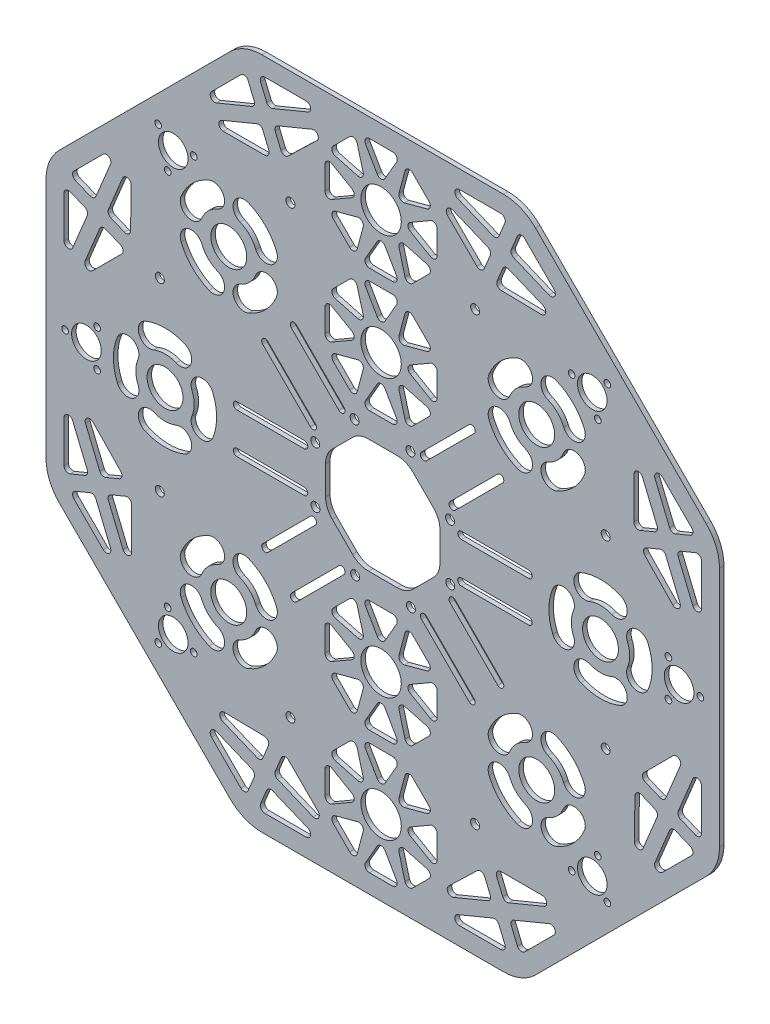
from build123d import *

# Parameters (mm, degrees)
EXTRUDE_1_DEPTH       = 2
SKETCH_2_R            = 6.6
SKETCH_2_R_2          = 1.5
CUT_EXTRUDE_1_DEPTH   = 10
CUT_EXTRUDE_2_DEPTH   = 10
MIRROR_4_COPY_1_DEPTH = 10
MIRROR_4_COPY_2_DEPTH = 10
FILLET_1_R            = 20
SKETCH_4_R            = 2
CUT_EXTRUDE_3_DEPTH   = 10
CUT_EXTRUDE_4_DEPTH   = 35
FILLET_2_R            = 10
SKETCH_6_R            = 2
CUT_EXTRUDE_5_DEPTH   = 35
SKETCH_9_R            = 8
CUT_EXTRUDE_8_DEPTH   = 10
SKETCH_10_R           = 9
CUT_EXTRUDE_9_DEPTH   = 10
FILLET_3_R            = 2


with BuildPart() as part:
    # 草图1 → 凸台-拉伸1 (new body)
    with BuildSketch(Plane.XY):
        Polygon((150, 62.132034356), (62.132034356, 150), (-62.132034356, 150), (-150, 62.132034356), (-150, -62.132034356), (-62.132034356, -150), (62.132034356, -150), (150, -62.132034356), align=None)
    extrude(amount=EXTRUDE_1_DEPTH)

    # 草图2 → 切除-拉伸1 (cut)
    with BuildSketch(Plane(origin=(0, 0, 0), x_dir=(-1, 0, 0), z_dir=(0, 0, -1))):
        with Locations((-132, 0)):
            Circle(SKETCH_2_R)
        with Locations((-141.5, 0)):
            Circle(SKETCH_2_R_2)
        with Locations((-127.25, 8.227241336)):
            Circle(SKETCH_2_R_2)
        with Locations((-127.25, -8.227241336)):
            Circle(SKETCH_2_R_2)
        with Locations((-93.338095117, 93.338095117)):
            Circle(SKETCH_2_R)
        with Locations((-100.055609538, 100.055609538)):
            Circle(SKETCH_2_R_2)
        with Locations((-84.161799767, 95.796876045)):
            Circle(SKETCH_2_R_2)
        with Locations((-95.796876045, 84.161799767)):
            Circle(SKETCH_2_R_2)
        with Locations((93.338095117, 93.338095117)):
            Circle(SKETCH_2_R)
        with Locations((100.055609538, 100.055609538)):
            Circle(SKETCH_2_R_2)
        with Locations((95.796876045, 84.161799767)):
            Circle(SKETCH_2_R_2)
        with Locations((84.161799767, 95.796876045)):
            Circle(SKETCH_2_R_2)
        with Locations((132, 0)):
            Circle(SKETCH_2_R)
        with Locations((141.5, 0)):
            Circle(SKETCH_2_R_2)
        with Locations((127.25, -8.227241336)):
            Circle(SKETCH_2_R_2)
        with Locations((127.25, 8.227241336)):
            Circle(SKETCH_2_R_2)
        with Locations((93.338095117, -93.338095117)):
            Circle(SKETCH_2_R)
        with Locations((100.055609538, -100.055609538)):
            Circle(SKETCH_2_R_2)
        with Locations((84.161799767, -95.796876045)):
            Circle(SKETCH_2_R_2)
        with Locations((95.796876045, -84.161799767)):
            Circle(SKETCH_2_R_2)
        with Locations((-93.338095117, -93.338095117)):
            Circle(SKETCH_2_R)
        with Locations((-100.055609538, -100.055609538)):
            Circle(SKETCH_2_R_2)
        with Locations((-95.796876045, -84.161799767)):
            Circle(SKETCH_2_R_2)
        with Locations((-84.161799767, -95.796876045)):
            Circle(SKETCH_2_R_2)
    extrude(amount=-CUT_EXTRUDE_1_DEPTH, mode=Mode.SUBTRACT)

    # 草图3 → 切除-拉伸2 (cut)
    with BuildSketch(Plane(origin=(0, 0, 0), x_dir=(-1, 0, 0), z_dir=(0, 0, -1))):
        with BuildLine():
            Line((-65, -7.4), (-35, -7.4))
            ThreePointArc((-35, -7.4), (-33.4, -9), (-35, -10.6))
            Line((-35, -10.6), (-65, -10.6))
            ThreePointArc((-65, -10.6), (-66.6, -9), (-65, -7.4))
        make_face()
        with BuildLine():
            Line((-65, 10.6), (-35, 10.6))
            ThreePointArc((-35, 10.6), (-33.4, 9), (-35, 7.4))
            Line((-35, 7.4), (-65, 7.4))
            ThreePointArc((-65, 7.4), (-66.6, 9), (-65, 10.6))
        make_face()
    cut_extrude_2 = extrude(amount=-CUT_EXTRUDE_2_DEPTH, mode=Mode.SUBTRACT)

    # 镜向2: 切除-拉伸2 across plane
    add(cut_extrude_2.mirror(Plane(origin=(0, 0, 0), x_dir=(0, 0, 1), z_dir=(-0.38268343236509006, 0.9238795325112866, 0))), mode=Mode.SUBTRACT)

    # 镜向3: 切除-拉伸2 across plane
    add(cut_extrude_2.mirror(Plane(origin=(0, 0, 0), x_dir=(0, 0, 1), z_dir=(0.38268343236508967, 0.9238795325112868, 0))), mode=Mode.SUBTRACT)

    # 镜向4: 切除-拉伸2 across plane
    add(cut_extrude_2.mirror(Plane(origin=(0, 0, 0), x_dir=(0, 0, 1), z_dir=(1, 0, 0))), mode=Mode.SUBTRACT)

    # 镜向4 copy 1 sketch → 镜向4 copy 1 (cut)
    with BuildSketch(Plane(origin=(0, 0, 0), x_dir=(0.707106781186547, -0.7071067811865479, 0), z_dir=(0, 0, -1))):
        with BuildLine():
            Line((-65, -7.4), (-35, -7.4))
            ThreePointArc((-35, -7.4), (-33.4, -9), (-35, -10.6))
            Line((-35, -10.6), (-65, -10.6))
            ThreePointArc((-65, -10.6), (-66.6, -9), (-65, -7.4))
        make_face()
        with BuildLine():
            Line((-65, 10.6), (-35, 10.6))
            ThreePointArc((-35, 10.6), (-33.4, 9), (-35, 7.4))
            Line((-35, 7.4), (-65, 7.4))
            ThreePointArc((-65, 7.4), (-66.6, 9), (-65, 10.6))
        make_face()
    extrude(amount=-MIRROR_4_COPY_1_DEPTH, mode=Mode.SUBTRACT)

    # 镜向4 copy 2 sketch → 镜向4 copy 2 (cut)
    with BuildSketch(Plane(origin=(0, 0, 0), x_dir=(0.7071067811865477, 0.7071067811865475, 0), z_dir=(0, 0, -1))):
        with BuildLine():
            Line((-65, -7.4), (-35, -7.4))
            ThreePointArc((-35, -7.4), (-33.4, -9), (-35, -10.6))
            Line((-35, -10.6), (-65, -10.6))
            ThreePointArc((-65, -10.6), (-66.6, -9), (-65, -7.4))
        make_face()
        with BuildLine():
            Line((-65, 10.6), (-35, 10.6))
            ThreePointArc((-35, 10.6), (-33.4, 9), (-35, 7.4))
            Line((-35, 7.4), (-65, 7.4))
            ThreePointArc((-65, 7.4), (-66.6, 9), (-65, 10.6))
        make_face()
    extrude(amount=-MIRROR_4_COPY_2_DEPTH, mode=Mode.SUBTRACT)

    # 圆角1
    fillet_1_edges = [part.edges().sort_by_distance(p)[0] for p in [
        (150, -62.132034356, 1),
        (62.132034356, -150, 1),
        (-62.132034356, -150, 1),
        (-150, -62.132034356, 1),
        (-150, 62.132034356, 1),
        (-62.132034356, 150, 1),
        (62.132034356, 150, 1),
        (150, 62.132034356, 1),
    ]]
    fillet(fillet_1_edges, radius=FILLET_1_R)

    # 草图4 → 切除-拉伸3 (cut)
    with BuildSketch(Plane(origin=(0, 0, 0), x_dir=(-1, 0, 0), z_dir=(0, 0, -1))):
        with Locations((-99.317049745, -41.138468979)):
            Circle(SKETCH_4_R)
        with Locations((-99.317049745, 41.138468979)):
            Circle(SKETCH_4_R)
        with Locations((-41.138468979, 99.317049745)):
            Circle(SKETCH_4_R)
        with Locations((41.138468979, 99.317049745)):
            Circle(SKETCH_4_R)
        with Locations((99.317049745, 41.138468979)):
            Circle(SKETCH_4_R)
        with Locations((99.317049745, -41.138468979)):
            Circle(SKETCH_4_R)
        with Locations((41.138468979, -99.317049745)):
            Circle(SKETCH_4_R)
        with Locations((-41.138468979, -99.317049745)):
            Circle(SKETCH_4_R)
    extrude(amount=-CUT_EXTRUDE_3_DEPTH, mode=Mode.SUBTRACT)

    # 草图5 → 切除-拉伸4 (cut)
    with BuildSketch(Plane.XY.offset(2)):
        Polygon((25.47687194, 10.552865884), (10.552865884, 25.47687194), (-10.552865884, 25.47687194), (-25.47687194, 10.552865884), (-25.47687194, -10.552865884), (-10.552865884, -25.47687194), (10.552865884, -25.47687194), (25.47687194, -10.552865884), align=None)
    extrude(amount=-CUT_EXTRUDE_4_DEPTH, mode=Mode.SUBTRACT)

    # 圆角2
    fillet_2_edges = [part.edges().sort_by_distance(p)[0] for p in [
        (25.47687194, 10.552865884, 1),
        (25.47687194, -10.552865884, 1),
        (10.552865884, -25.47687194, 1),
        (-10.552865884, -25.47687194, 1),
        (-25.47687194, -10.552865884, 1),
        (-25.47687194, 10.552865884, 1),
        (-10.552865884, 25.47687194, 1),
        (10.552865884, 25.47687194, 1),
    ]]
    fillet(fillet_2_edges, radius=FILLET_2_R)

    # 草图6 → 切除-拉伸5 (cut)
    with BuildSketch(Plane.XY.offset(2)):
        with Locations((-30.071355541, 12.327350727)):
            Circle(SKETCH_6_R)
        with Locations((-12.546906129, 29.980412716)):
            Circle(SKETCH_6_R)
        with Locations((12.327350727, 30.071355541)):
            Circle(SKETCH_6_R)
        with Locations((29.980412716, 12.546906129)):
            Circle(SKETCH_6_R)
        with Locations((30.071355541, -12.327350727)):
            Circle(SKETCH_6_R)
        with Locations((12.546906129, -29.980412716)):
            Circle(SKETCH_6_R)
        with Locations((-12.327350727, -30.071355541)):
            Circle(SKETCH_6_R)
        with Locations((-29.980412716, -12.546906129)):
            Circle(SKETCH_6_R)
    extrude(amount=-CUT_EXTRUDE_5_DEPTH, mode=Mode.SUBTRACT)

    # 草图9 → 切除-拉伸8 (cut)
    with BuildSketch(Plane.XY.offset(2)):
        with Locations((97, 0)):
            Circle(SKETCH_9_R)
        with Locations((68.589357775, -68.589357775)):
            Circle(SKETCH_9_R)
        with Locations((-68.589357775, -68.589357775)):
            Circle(SKETCH_9_R)
        with Locations((-97, 0)):
            Circle(SKETCH_9_R)
        with Locations((-68.589357775, 68.589357775)):
            Circle(SKETCH_9_R)
        with Locations((68.589357775, 68.589357775)):
            Circle(SKETCH_9_R)
        with BuildLine():
            ThreePointArc((88.198281056, -21.249229248), (97, -23), (105.801718944, -21.249229248))
            ThreePointArc((105.801718944, -21.249229248), (108.507699445, -14.716414423), (101.974884621, -12.010433923))
            ThreePointArc((101.974884621, -12.010433923), (97, -13), (92.025115379, -12.010433923))
            ThreePointArc((92.025115379, -12.010433923), (85.492300555, -14.716414423), (88.198281056, -21.249229248))
        make_face()
        with BuildLine():
            ThreePointArc((75.750770752, 8.801718944), (74, 0), (75.750770752, -8.801718944))
            ThreePointArc((75.750770752, -8.801718944), (82.283585577, -11.507699445), (84.989566077, -4.974884621))
            ThreePointArc((84.989566077, -4.974884621), (84, 0), (84.989566077, 4.974884621))
            ThreePointArc((84.989566077, 4.974884621), (82.283585577, 11.507699445), (75.750770752, 8.801718944))
        make_face()
        with BuildLine():
            ThreePointArc((105.801718944, 21.249229248), (97, 23), (88.198281056, 21.249229248))
            ThreePointArc((88.198281056, 21.249229248), (85.492300555, 14.716414423), (92.025115379, 12.010433923))
            ThreePointArc((92.025115379, 12.010433923), (97, 13), (101.974884621, 12.010433923))
            ThreePointArc((101.974884621, 12.010433923), (108.507699445, 14.716414423), (105.801718944, 21.249229248))
        make_face()
        with BuildLine():
            ThreePointArc((118.249229248, -8.801718944), (120, 0), (118.249229248, 8.801718944))
            ThreePointArc((118.249229248, 8.801718944), (111.716414423, 11.507699445), (109.010433923, 4.974884621))
            ThreePointArc((109.010433923, 4.974884621), (110, 0), (109.010433923, -4.974884621))
            ThreePointArc((109.010433923, -4.974884621), (111.716414423, -11.507699445), (118.249229248, -8.801718944))
        make_face()
        with BuildLine():
            ThreePointArc((47.340128527, -77.391076719), (52.325901808, -84.852813742), (59.787638831, -89.838587023))
            ThreePointArc((59.787638831, -89.838587023), (66.320453655, -87.132606522), (63.614473154, -80.599791698))
            ThreePointArc((63.614473154, -80.599791698), (59.39696962, -77.781745931), (56.578923852, -73.564242396))
            ThreePointArc((56.578923852, -73.564242396), (50.046109028, -70.858261895), (47.340128527, -77.391076719))
        make_face()
        with BuildLine():
            ThreePointArc((59.787638831, -47.340128527), (52.325901808, -52.325901808), (47.340128527, -59.787638831))
            ThreePointArc((47.340128527, -59.787638831), (50.046109028, -66.320453655), (56.578923852, -63.614473154))
            ThreePointArc((56.578923852, -63.614473154), (59.39696962, -59.39696962), (63.614473154, -56.578923852))
            ThreePointArc((63.614473154, -56.578923852), (66.320453655, -50.046109028), (59.787638831, -47.340128527))
        make_face()
        with BuildLine():
            ThreePointArc((89.838587023, -59.787638831), (84.852813742, -52.325901808), (77.391076719, -47.340128527))
            ThreePointArc((77.391076719, -47.340128527), (70.858261895, -50.046109028), (73.564242396, -56.578923852))
            ThreePointArc((73.564242396, -56.578923852), (77.781745931, -59.39696962), (80.599791698, -63.614473154))
            ThreePointArc((80.599791698, -63.614473154), (87.132606522, -66.320453655), (89.838587023, -59.787638831))
        make_face()
        with BuildLine():
            ThreePointArc((77.391076719, -89.838587023), (84.852813742, -84.852813742), (89.838587023, -77.391076719))
            ThreePointArc((89.838587023, -77.391076719), (87.132606522, -70.858261895), (80.599791698, -73.564242396))
            ThreePointArc((80.599791698, -73.564242396), (77.781745931, -77.781745931), (73.564242396, -80.599791698))
            ThreePointArc((73.564242396, -80.599791698), (70.858261895, -87.132606522), (77.391076719, -89.838587023))
        make_face()
        with BuildLine():
            ThreePointArc((-77.391076719, -47.340128527), (-84.852813742, -52.325901808), (-89.838587023, -59.787638831))
            ThreePointArc((-89.838587023, -59.787638831), (-87.132606522, -66.320453655), (-80.599791698, -63.614473154))
            ThreePointArc((-80.599791698, -63.614473154), (-77.781745931, -59.39696962), (-73.564242396, -56.578923852))
            ThreePointArc((-73.564242396, -56.578923852), (-70.858261895, -50.046109028), (-77.391076719, -47.340128527))
        make_face()
        with BuildLine():
            ThreePointArc((-47.340128527, -59.787638831), (-52.325901808, -52.325901808), (-59.787638831, -47.340128527))
            ThreePointArc((-59.787638831, -47.340128527), (-66.320453655, -50.046109028), (-63.614473154, -56.578923852))
            ThreePointArc((-63.614473154, -56.578923852), (-59.39696962, -59.39696962), (-56.578923852, -63.614473154))
            ThreePointArc((-56.578923852, -63.614473154), (-50.046109028, -66.320453655), (-47.340128527, -59.787638831))
        make_face()
        with BuildLine():
            ThreePointArc((-59.787638831, -89.838587023), (-52.325901808, -84.852813742), (-47.340128527, -77.391076719))
            ThreePointArc((-47.340128527, -77.391076719), (-50.046109028, -70.858261895), (-56.578923852, -73.564242396))
            ThreePointArc((-56.578923852, -73.564242396), (-59.39696962, -77.781745931), (-63.614473154, -80.599791698))
            ThreePointArc((-63.614473154, -80.599791698), (-66.320453655, -87.132606522), (-59.787638831, -89.838587023))
        make_face()
        with BuildLine():
            ThreePointArc((-89.838587023, -77.391076719), (-84.852813742, -84.852813742), (-77.391076719, -89.838587023))
            ThreePointArc((-77.391076719, -89.838587023), (-70.858261895, -87.132606522), (-73.564242396, -80.599791698))
            ThreePointArc((-73.564242396, -80.599791698), (-77.781745931, -77.781745931), (-80.599791698, -73.564242396))
            ThreePointArc((-80.599791698, -73.564242396), (-87.132606522, -70.858261895), (-89.838587023, -77.391076719))
        make_face()
        with BuildLine():
            ThreePointArc((-88.198281056, 21.249229248), (-97, 23), (-105.801718944, 21.249229248))
            ThreePointArc((-105.801718944, 21.249229248), (-108.507699445, 14.716414423), (-101.974884621, 12.010433923))
            ThreePointArc((-101.974884621, 12.010433923), (-97, 13), (-92.025115379, 12.010433923))
            ThreePointArc((-92.025115379, 12.010433923), (-85.492300555, 14.716414423), (-88.198281056, 21.249229248))
        make_face()
        with BuildLine():
            ThreePointArc((-75.750770752, -8.801718944), (-74, 0), (-75.750770752, 8.801718944))
            ThreePointArc((-75.750770752, 8.801718944), (-82.283585577, 11.507699445), (-84.989566077, 4.974884621))
            ThreePointArc((-84.989566077, 4.974884621), (-84, 0), (-84.989566077, -4.974884621))
            ThreePointArc((-84.989566077, -4.974884621), (-82.283585577, -11.507699445), (-75.750770752, -8.801718944))
        make_face()
        with BuildLine():
            ThreePointArc((-105.801718944, -21.249229248), (-97, -23), (-88.198281056, -21.249229248))
            ThreePointArc((-88.198281056, -21.249229248), (-85.492300555, -14.716414423), (-92.025115379, -12.010433923))
            ThreePointArc((-92.025115379, -12.010433923), (-97, -13), (-101.974884621, -12.010433923))
            ThreePointArc((-101.974884621, -12.010433923), (-108.507699445, -14.716414423), (-105.801718944, -21.249229248))
        make_face()
        with BuildLine():
            ThreePointArc((-118.249229248, 8.801718944), (-120, 0), (-118.249229248, -8.801718944))
            ThreePointArc((-118.249229248, -8.801718944), (-111.716414423, -11.507699445), (-109.010433923, -4.974884621))
            ThreePointArc((-109.010433923, -4.974884621), (-110, 0), (-109.010433923, 4.974884621))
            ThreePointArc((-109.010433923, 4.974884621), (-111.716414423, 11.507699445), (-118.249229248, 8.801718944))
        make_face()
        with BuildLine():
            ThreePointArc((-47.340128527, 77.391076719), (-52.325901808, 84.852813742), (-59.787638831, 89.838587023))
            ThreePointArc((-59.787638831, 89.838587023), (-66.320453655, 87.132606522), (-63.614473154, 80.599791698))
            ThreePointArc((-63.614473154, 80.599791698), (-59.39696962, 77.781745931), (-56.578923852, 73.564242396))
            ThreePointArc((-56.578923852, 73.564242396), (-50.046109028, 70.858261895), (-47.340128527, 77.391076719))
        make_face()
        with BuildLine():
            ThreePointArc((-59.787638831, 47.340128527), (-52.325901808, 52.325901808), (-47.340128527, 59.787638831))
            ThreePointArc((-47.340128527, 59.787638831), (-50.046109028, 66.320453655), (-56.578923852, 63.614473154))
            ThreePointArc((-56.578923852, 63.614473154), (-59.39696962, 59.39696962), (-63.614473154, 56.578923852))
            ThreePointArc((-63.614473154, 56.578923852), (-66.320453655, 50.046109028), (-59.787638831, 47.340128527))
        make_face()
        with BuildLine():
            ThreePointArc((-89.838587023, 59.787638831), (-84.852813742, 52.325901808), (-77.391076719, 47.340128527))
            ThreePointArc((-77.391076719, 47.340128527), (-70.858261895, 50.046109028), (-73.564242396, 56.578923852))
            ThreePointArc((-73.564242396, 56.578923852), (-77.781745931, 59.39696962), (-80.599791698, 63.614473154))
            ThreePointArc((-80.599791698, 63.614473154), (-87.132606522, 66.320453655), (-89.838587023, 59.787638831))
        make_face()
        with BuildLine():
            ThreePointArc((-77.391076719, 89.838587023), (-84.852813742, 84.852813742), (-89.838587023, 77.391076719))
            ThreePointArc((-89.838587023, 77.391076719), (-87.132606522, 70.858261895), (-80.599791698, 73.564242396))
            ThreePointArc((-80.599791698, 73.564242396), (-77.781745931, 77.781745931), (-73.564242396, 80.599791698))
            ThreePointArc((-73.564242396, 80.599791698), (-70.858261895, 87.132606522), (-77.391076719, 89.838587023))
        make_face()
        with BuildLine():
            ThreePointArc((77.391076719, 47.340128527), (84.852813742, 52.325901808), (89.838587023, 59.787638831))
            ThreePointArc((89.838587023, 59.787638831), (87.132606522, 66.320453655), (80.599791698, 63.614473154))
            ThreePointArc((80.599791698, 63.614473154), (77.781745931, 59.39696962), (73.564242396, 56.578923852))
            ThreePointArc((73.564242396, 56.578923852), (70.858261895, 50.046109028), (77.391076719, 47.340128527))
        make_face()
        with BuildLine():
            ThreePointArc((47.340128527, 59.787638831), (52.325901808, 52.325901808), (59.787638831, 47.340128527))
            ThreePointArc((59.787638831, 47.340128527), (66.320453655, 50.046109028), (63.614473154, 56.578923852))
            ThreePointArc((63.614473154, 56.578923852), (59.39696962, 59.39696962), (56.578923852, 63.614473154))
            ThreePointArc((56.578923852, 63.614473154), (50.046109028, 66.320453655), (47.340128527, 59.787638831))
        make_face()
        with BuildLine():
            ThreePointArc((59.787638831, 89.838587023), (52.325901808, 84.852813742), (47.340128527, 77.391076719))
            ThreePointArc((47.340128527, 77.391076719), (50.046109028, 70.858261895), (56.578923852, 73.564242396))
            ThreePointArc((56.578923852, 73.564242396), (59.39696962, 77.781745931), (63.614473154, 80.599791698))
            ThreePointArc((63.614473154, 80.599791698), (66.320453655, 87.132606522), (59.787638831, 89.838587023))
        make_face()
        with BuildLine():
            ThreePointArc((89.838587023, 77.391076719), (84.852813742, 84.852813742), (77.391076719, 89.838587023))
            ThreePointArc((77.391076719, 89.838587023), (70.858261895, 87.132606522), (73.564242396, 80.599791698))
            ThreePointArc((73.564242396, 80.599791698), (77.781745931, 77.781745931), (80.599791698, 73.564242396))
            ThreePointArc((80.599791698, 73.564242396), (87.132606522, 70.858261895), (89.838587023, 77.391076719))
        make_face()
    extrude(amount=-CUT_EXTRUDE_8_DEPTH, mode=Mode.SUBTRACT)

    # 草图10 → 切除-拉伸9 (cut)
    with BuildSketch(Plane.XY.offset(2)):
        with Locations((-0.743983155, -61.624947898)):
            Circle(SKETCH_10_R)
        with Locations((-0.743983155, -116.624947898)):
            Circle(SKETCH_10_R)
        with Locations((-0.743983155, 61.624947898)):
            Circle(SKETCH_10_R)
        with Locations((-0.743983155, 116.624947898)):
            Circle(SKETCH_10_R)
        Polygon((6.327084657, -54.553880086), (23.057410732, -50.071002725), (10.809962018, -37.823554011), align=None)
        Polygon((-0.743983155, -51.624947898), (7.916270883, -36.624947898), (-9.404237193, -36.624947898), align=None)
        Polygon((9.256016845, -61.624947898), (24.256016845, -70.285201936), (24.256016845, -52.96469386), align=None)
        Polygon((6.327084657, -68.69601571), (10.809962018, -85.426341784), (23.057410732, -73.17889307), align=None)
        Polygon((-0.743983155, -71.624947898), (-9.404237193, -86.624947898), (7.916270883, -86.624947898), align=None)
        Polygon((-7.815050967, -68.69601571), (-24.545377041, -73.17889307), (-12.297928327, -85.426341784), align=None)
        Polygon((-10.743983155, -61.624947898), (-25.743983155, -52.96469386), (-25.743983155, -70.285201936), align=None)
        Polygon((-7.815050967, -54.553880086), (-12.297928327, -37.823554011), (-24.545377041, -50.071002725), align=None)
        Polygon((6.327084657, -109.553880086), (23.057410732, -105.071002725), (10.809962018, -92.823554011), align=None)
        Polygon((-0.743983155, -106.624947898), (7.916270883, -91.624947898), (-9.404237193, -91.624947898), align=None)
        Polygon((9.256016845, -116.624947898), (24.256016845, -125.285201936), (24.256016845, -107.96469386), align=None)
        Polygon((6.327084657, -123.69601571), (10.809962018, -140.426341784), (23.057410732, -128.17889307), align=None)
        Polygon((-0.743983155, -126.624947898), (-9.404237193, -141.624947898), (7.916270883, -141.624947898), align=None)
        Polygon((-7.815050967, -123.69601571), (-24.545377041, -128.17889307), (-12.297928327, -140.426341784), align=None)
        Polygon((-10.743983155, -116.624947898), (-25.743983155, -107.96469386), (-25.743983155, -125.285201936), align=None)
        Polygon((-7.815050967, -109.553880086), (-12.297928327, -92.823554011), (-24.545377041, -105.071002725), align=None)
        Polygon((83.407078974, -117.411246883), (61.114426451, -139.703899406), (56.497466943, -128.557573144), align=None)
        Polygon((55.571149256, -142), (24.044577716, -142), (50.954189748, -130.853673738), align=None)
        Polygon((21.748477122, -136.456722805), (44.26530041, -114.705266382), (48.658089154, -125.310396543), align=None)
        Polygon((49.584406841, -111.867969688), (81.11097838, -111.867969688), (54.201366349, -123.014295949), align=None)
        Polygon((-24.044577716, -142), (-55.571149256, -142), (-50.954189748, -130.853673738), align=None)
        Polygon((-61.114426451, -139.703899406), (-83.407078974, -117.411246883), (-56.497466943, -128.557573144), align=None)
        Polygon((-81.11097838, -111.867969688), (-49.808577605, -112.409165788), (-54.201366349, -123.014295949), align=None)
        Polygon((-44.041129646, -114.164070282), (-21.748477122, -136.456722805), (-48.658089154, -125.310396543), align=None)
        Polygon((-117.411246883, -83.407078974), (-139.703899406, -61.114426451), (-128.557573144, -56.497466943), align=None)
        Polygon((-142, -55.571149256), (-142, -24.044577716), (-130.853673738, -50.954189748), align=None)
        Polygon((-136.456722805, -21.748477122), (-114.705266382, -44.26530041), (-125.310396543, -48.658089154), align=None)
        Polygon((-111.867969688, -49.584406841), (-111.867969688, -81.11097838), (-123.014295949, -54.201366349), align=None)
        Polygon((-142, 24.044577716), (-142, 55.571149256), (-130.853673738, 50.954189748), align=None)
        Polygon((-139.703899406, 61.114426451), (-117.411246883, 83.407078974), (-128.557573144, 56.497466943), align=None)
        Polygon((-111.867969688, 81.11097838), (-112.409165788, 49.808577605), (-123.014295949, 54.201366349), align=None)
        Polygon((-114.164070282, 44.041129646), (-136.456722805, 21.748477122), (-125.310396543, 48.658089154), align=None)
        Polygon((-83.407078974, 117.411246883), (-61.114426451, 139.703899406), (-56.497466943, 128.557573144), align=None)
        Polygon((-55.571149256, 142), (-24.044577716, 142), (-50.954189748, 130.853673738), align=None)
        Polygon((-21.748477122, 136.456722805), (-44.26530041, 114.705266382), (-48.658089154, 125.310396543), align=None)
        Polygon((-49.584406841, 111.867969688), (-81.11097838, 111.867969688), (-54.201366349, 123.014295949), align=None)
        Polygon((24.044577716, 142), (55.571149256, 142), (50.954189748, 130.853673738), align=None)
        Polygon((61.114426451, 139.703899406), (83.407078974, 117.411246883), (56.497466943, 128.557573144), align=None)
        Polygon((81.11097838, 111.867969688), (49.808577605, 112.409165788), (54.201366349, 123.014295949), align=None)
        Polygon((44.041129646, 114.164070282), (21.748477122, 136.456722805), (48.658089154, 125.310396543), align=None)
        Polygon((117.411246883, 83.407078974), (139.703899406, 61.114426451), (128.557573144, 56.497466943), align=None)
        Polygon((142, 55.571149256), (142, 24.044577716), (130.853673738, 50.954189748), align=None)
        Polygon((136.456722805, 21.748477122), (114.705266382, 44.26530041), (125.310396543, 48.658089154), align=None)
        Polygon((111.867969688, 49.584406841), (111.867969688, 81.11097838), (123.014295949, 54.201366349), align=None)
        Polygon((142, -24.044577716), (142, -55.571149256), (130.853673738, -50.954189748), align=None)
        Polygon((139.703899406, -61.114426451), (117.411246883, -83.407078974), (128.557573144, -56.497466943), align=None)
        Polygon((111.867969688, -81.11097838), (112.409165788, -49.808577605), (123.014295949, -54.201366349), align=None)
        Polygon((114.164070282, -44.041129646), (136.456722805, -21.748477122), (125.310396543, -48.658089154), align=None)
        Polygon((-12.297928327, 37.823554011), (-24.545377041, 50.071002725), (-7.815050967, 54.553880086), align=None)
        Polygon((-25.743983155, 52.96469386), (-25.743983155, 70.285201936), (-10.743983155, 61.624947898), align=None)
        Polygon((-24.545377041, 73.17889307), (-12.297928327, 85.426341784), (-7.815050967, 68.69601571), align=None)
        Polygon((-9.404237193, 86.624947898), (7.916270883, 86.624947898), (-0.743983155, 71.624947898), align=None)
        Polygon((10.809962018, 85.426341784), (23.057410732, 73.17889307), (6.327084657, 68.69601571), align=None)
        Polygon((24.256016845, 70.285201936), (24.256016845, 52.96469386), (9.256016845, 61.624947898), align=None)
        Polygon((23.057410732, 50.071002725), (10.809962018, 37.823554011), (6.327084657, 54.553880086), align=None)
        Polygon((-9.404237193, 36.624947898), (-0.743983155, 51.624947898), (7.916270883, 36.624947898), align=None)
        Polygon((24.256016845, 125.285201936), (24.256016845, 107.96469386), (9.256016845, 116.624947898), align=None)
        Polygon((7.916270883, 91.624947898), (-9.404237193, 91.624947898), (-0.743983155, 106.624947898), align=None)
        Polygon((-25.743983155, 107.96469386), (-25.743983155, 125.285201936), (-10.743983155, 116.624947898), align=None)
        Polygon((-9.404237193, 141.624947898), (7.916270883, 141.624947898), (-0.743983155, 126.624947898), align=None)
        Polygon((-12.297928327, 92.823554011), (-24.545377041, 105.071002725), (-7.815050967, 109.553880086), align=None)
        Polygon((-24.545377041, 128.17889307), (-12.297928327, 140.426341784), (-7.815050967, 123.69601571), align=None)
        Polygon((10.809962018, 140.426341784), (23.057410732, 128.17889307), (6.327084657, 123.69601571), align=None)
        Polygon((23.057410732, 105.071002725), (10.809962018, 92.823554011), (6.327084657, 109.553880086), align=None)
    extrude(amount=-CUT_EXTRUDE_9_DEPTH, mode=Mode.SUBTRACT)

    # 圆角3
    fillet_3_edges = [part.edges().sort_by_distance(p)[0] for p in [
        (-44.26530041, 114.705266382, 1),
        (-48.658089154, 125.310396543, 1),
        (-21.748477122, 136.456722805, 1),
        (-24.044577716, 142, 1),
        (-50.954189748, 130.853673738, 1),
        (-55.571149256, 142, 1),
        (-56.497466943, 128.557573144, 1),
        (-83.407078974, 117.411246883, 1),
        (-61.114426451, 139.703899406, 1),
        (-81.11097838, 111.867969688, 1),
        (-54.201366349, 123.014295949, 1),
        (-49.584406841, 111.867969688, 1),
        (49.808577605, 112.409165788, 1),
        (54.201366349, 123.014295949, 1),
        (81.11097838, 111.867969688, 1),
        (83.407078974, 117.411246883, 1),
        (56.497466943, 128.557573144, 1),
        (61.114426451, 139.703899406, 1),
        (50.954189748, 130.853673738, 1),
        (24.044577716, 142, 1),
        (55.571149256, 142, 1),
        (21.748477122, 136.456722805, 1),
        (48.658089154, 125.310396543, 1),
        (44.041129646, 114.164070282, 1),
        (136.456722805, -21.748477122, 1),
        (125.310396543, -48.658089154, 1),
        (114.164070282, -44.041129646, 1),
        (130.853673738, -50.954189748, 1),
        (142, -24.044577716, 1),
        (142, -55.571149256, 1),
        (117.411246883, -83.407078974, 1),
        (128.557573144, -56.497466943, 1),
        (139.703899406, -61.114426451, 1),
        (112.409165788, -49.808577605, 1),
        (123.014295949, -54.201366349, 1),
        (111.867969688, -81.11097838, 1),
        (111.867969688, 81.11097838, 1),
        (123.014295949, 54.201366349, 1),
        (111.867969688, 49.584406841, 1),
        (128.557573144, 56.497466943, 1),
        (117.411246883, 83.407078974, 1),
        (139.703899406, 61.114426451, 1),
        (142, 24.044577716, 1),
        (130.853673738, 50.954189748, 1),
        (142, 55.571149256, 1),
        (114.705266382, 44.26530041, 1),
        (125.310396543, 48.658089154, 1),
        (136.456722805, 21.748477122, 1),
        (9.256016845, 61.624947898, 1),
        (24.256016845, 70.285201936, 1),
        (24.256016845, 52.96469386, 1),
        (6.327084657, 68.69601571, 1),
        (10.809962018, 85.426341784, 1),
        (23.057410732, 73.17889307, 1),
        (7.916270883, 36.624947898, 1),
        (-9.404237193, 36.624947898, 1),
        (-0.743983155, 51.624947898, 1),
        (6.327084657, 54.553880086, 1),
        (23.057410732, 50.071002725, 1),
        (10.809962018, 37.823554011, 1),
        (-10.743983155, 61.624947898, 1),
        (-25.743983155, 52.96469386, 1),
        (-25.743983155, 70.285201936, 1),
        (-7.815050967, 54.553880086, 1),
        (-12.297928327, 37.823554011, 1),
        (-24.545377041, 50.071002725, 1),
        (-0.743983155, 71.624947898, 1),
        (-9.404237193, 86.624947898, 1),
        (7.916270883, 86.624947898, 1),
        (-7.815050967, 68.69601571, 1),
        (-24.545377041, 73.17889307, 1),
        (-12.297928327, 85.426341784, 1),
        (-0.743983155, 126.624947898, 1),
        (-9.404237193, 141.624947898, 1),
        (7.916270883, 141.624947898, 1),
        (-7.815050967, 109.553880086, 1),
        (-12.297928327, 92.823554011, 1),
        (-24.545377041, 105.071002725, 1),
        (-7.815050967, 123.69601571, 1),
        (-24.545377041, 128.17889307, 1),
        (-12.297928327, 140.426341784, 1),
        (6.327084657, 123.69601571, 1),
        (10.809962018, 140.426341784, 1),
        (23.057410732, 128.17889307, 1),
        (6.327084657, 109.553880086, 1),
        (23.057410732, 105.071002725, 1),
        (10.809962018, 92.823554011, 1),
        (9.256016845, 116.624947898, 1),
        (24.256016845, 125.285201936, 1),
        (24.256016845, 107.96469386, 1),
        (-0.743983155, 106.624947898, 1),
        (7.916270883, 91.624947898, 1),
        (-9.404237193, 91.624947898, 1),
        (-10.743983155, 116.624947898, 1),
        (-25.743983155, 107.96469386, 1),
        (-25.743983155, 125.285201936, 1),
        (-7.815050967, -68.69601571, 1),
        (-12.297928327, -85.426341784, 1),
        (-24.545377041, -73.17889307, 1),
        (-0.743983155, -71.624947898, 1),
        (7.916270883, -86.624947898, 1),
        (-9.404237193, -86.624947898, 1),
        (-7.815050967, -54.553880086, 1),
        (-24.545377041, -50.071002725, 1),
        (-12.297928327, -37.823554011, 1),
        (-10.743983155, -61.624947898, 1),
        (-25.743983155, -70.285201936, 1),
        (-25.743983155, -52.96469386, 1),
        (6.327084657, -54.553880086, 1),
        (10.809962018, -37.823554011, 1),
        (23.057410732, -50.071002725, 1),
        (-0.743983155, -51.624947898, 1),
        (-9.404237193, -36.624947898, 1),
        (7.916270883, -36.624947898, 1),
        (6.327084657, -68.69601571, 1),
        (23.057410732, -73.17889307, 1),
        (10.809962018, -85.426341784, 1),
        (9.256016845, -61.624947898, 1),
        (24.256016845, -52.96469386, 1),
        (24.256016845, -70.285201936, 1),
        (-0.743983155, -126.624947898, 1),
        (7.916270883, -141.624947898, 1),
        (-9.404237193, -141.624947898, 1),
        (6.327084657, -123.69601571, 1),
        (23.057410732, -128.17889307, 1),
        (10.809962018, -140.426341784, 1),
        (-10.743983155, -116.624947898, 1),
        (-25.743983155, -125.285201936, 1),
        (-25.743983155, -107.96469386, 1),
        (-7.815050967, -123.69601571, 1),
        (-12.297928327, -140.426341784, 1),
        (-24.545377041, -128.17889307, 1),
        (-0.743983155, -106.624947898, 1),
        (-9.404237193, -91.624947898, 1),
        (7.916270883, -91.624947898, 1),
        (9.256016845, -116.624947898, 1),
        (24.256016845, -107.96469386, 1),
        (24.256016845, -125.285201936, 1),
        (6.327084657, -109.553880086, 1),
        (10.809962018, -92.823554011, 1),
        (23.057410732, -105.071002725, 1),
        (-114.705266382, -44.26530041, 1),
        (-125.310396543, -48.658089154, 1),
        (-136.456722805, -21.748477122, 1),
        (-111.867969688, -81.11097838, 1),
        (-123.014295949, -54.201366349, 1),
        (-111.867969688, -49.584406841, 1),
        (-128.557573144, -56.497466943, 1),
        (-117.411246883, -83.407078974, 1),
        (-139.703899406, -61.114426451, 1),
        (-83.407078974, -117.411246883, 1),
        (-56.497466943, -128.557573144, 1),
        (-61.114426451, -139.703899406, 1),
        (-112.409165788, 49.808577605, 1),
        (-123.014295949, 54.201366349, 1),
        (-111.867969688, 81.11097838, 1),
        (-117.411246883, 83.407078974, 1),
        (-128.557573144, 56.497466943, 1),
        (-139.703899406, 61.114426451, 1),
        (-136.456722805, 21.748477122, 1),
        (-125.310396543, 48.658089154, 1),
        (-114.164070282, 44.041129646, 1),
        (-130.853673738, 50.954189748, 1),
        (-142, 24.044577716, 1),
        (-142, 55.571149256, 1),
        (-142, -24.044577716, 1),
        (-130.853673738, -50.954189748, 1),
        (-142, -55.571149256, 1),
        (44.26530041, -114.705266382, 1),
        (48.658089154, -125.310396543, 1),
        (21.748477122, -136.456722805, 1),
        (81.11097838, -111.867969688, 1),
        (54.201366349, -123.014295949, 1),
        (49.584406841, -111.867969688, 1),
        (56.497466943, -128.557573144, 1),
        (83.407078974, -117.411246883, 1),
        (61.114426451, -139.703899406, 1),
        (-7.815050967, -109.553880086, 1),
        (-24.545377041, -105.071002725, 1),
        (-12.297928327, -92.823554011, 1),
        (-49.808577605, -112.409165788, 1),
        (-54.201366349, -123.014295949, 1),
        (-81.11097838, -111.867969688, 1),
        (-21.748477122, -136.456722805, 1),
        (-48.658089154, -125.310396543, 1),
        (-44.041129646, -114.164070282, 1),
        (-50.954189748, -130.853673738, 1),
        (-24.044577716, -142, 1),
        (-55.571149256, -142, 1),
        (24.044577716, -142, 1),
        (50.954189748, -130.853673738, 1),
        (55.571149256, -142, 1),
    ]]
    fillet(fillet_3_edges, radius=FILLET_3_R)


solid = part.part
